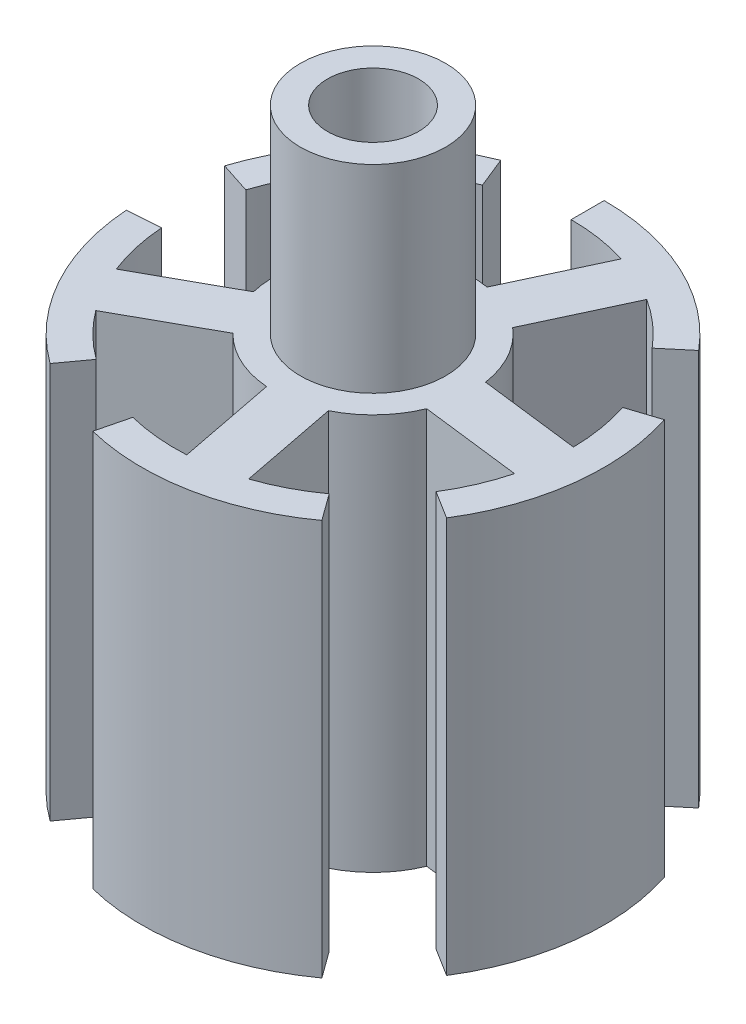
from build123d import *

# Parameters (mm, degrees)
BOSS_EXTRUDE2_DEPTH   = 30
BOSS_EXTRUDE2_2_DEPTH = 30
BOSS_EXTRUDE2_3_DEPTH = 30
BOSS_EXTRUDE2_4_DEPTH = 30
BOSS_EXTRUDE2_5_DEPTH = 30
BOSS_EXTRUDE3_DEPTH   = 30
SKETCH3_R             = 7.5
BOSS_EXTRUDE4_DEPTH   = 30
SKETCH5_R             = 5.5
BOSS_EXTRUDE5_DEPTH   = 15
SKETCH4_R             = 3.45
CUT_EXTRUDE1_DEPTH    = 52.35659646


with BuildPart() as part:
    # Sketch1 → Boss-Extrude2 (new body)
    with BuildSketch(Plane(origin=(0, 0, 0), x_dir=(1, 0, 0), z_dir=(0, 1, 0))):
        with BuildLine():
            Line((0, 17.5), (0, 15))
            ThreePointArc((0, 15), (6.339273926, 13.594616806), (11.490666647, 9.641814145))
            Line((11.490666647, 9.641814145), (13.405777755, 11.24878317))
            ThreePointArc((13.405777755, 11.24878317), (7.39581958, 15.860386273), (0, 17.5))
        make_face()
    extrude(amount=BOSS_EXTRUDE2_DEPTH)



with BuildPart() as body_2:
    # Sketch1 → Boss-Extrude2 2 (new body)
    with BuildSketch(Plane(origin=(0, 0, 0), x_dir=(1, 0, 0), z_dir=(0, 1, 0))):
        with BuildLine():
            Line((16.643489035, 5.407797402), (14.265847744, 4.635254916))
            ThreePointArc((14.265847744, 4.635254916), (14.888192275, -1.828040151), (12.720721442, -7.948788963))
            Line((12.720721442, -7.948788963), (14.840841683, -9.273587124))
            ThreePointArc((14.840841683, -9.273587124), (17.369557654, -2.13271351), (16.643489035, 5.407797402))
        make_face()
    extrude(amount=BOSS_EXTRUDE2_2_DEPTH)


with BuildPart() as body_3:
    # Sketch1 → Boss-Extrude2 3 (new body)
    with BuildSketch(Plane(origin=(0, 0, 0), x_dir=(1, 0, 0), z_dir=(0, 1, 0))):
        with BuildLine():
            Line((10.286241915, -14.157797402), (8.816778784, -12.135254916))
            ThreePointArc((8.816778784, -12.135254916), (2.862134931, -14.724407752), (-3.628828434, -14.554435894))
            Line((-3.628828434, -14.554435894), (-4.233633173, -16.98017521))
            ThreePointArc((-4.233633173, -16.98017521), (3.339157419, -17.17847571), (10.286241915, -14.157797402))
        make_face()
    extrude(amount=BOSS_EXTRUDE2_3_DEPTH)


with BuildPart() as body_4:
    # Sketch1 → Boss-Extrude2 4 (new body)
    with BuildSketch(Plane(origin=(0, 0, 0), x_dir=(1, 0, 0), z_dir=(0, 1, 0))):
        with BuildLine():
            Line((-10.286241915, -14.157797402), (-8.816778784, -12.135254916))
            ThreePointArc((-8.816778784, -12.135254916), (-13.119295607, -7.272144304), (-14.963460754, -1.046347106))
            Line((-14.963460754, -1.046347106), (-17.45737088, -1.220738291))
            ThreePointArc((-17.45737088, -1.220738291), (-15.305844875, -8.484168354), (-10.286241915, -14.157797402))
        make_face()
    extrude(amount=BOSS_EXTRUDE2_4_DEPTH)


with BuildPart() as body_5:
    # Sketch1 → Boss-Extrude2 5 (new body)
    with BuildSketch(Plane(origin=(0, 0, 0), x_dir=(1, 0, 0), z_dir=(0, 1, 0))):
        with BuildLine():
            Line((-16.643489035, 5.407797402), (-14.265847744, 4.635254916))
            ThreePointArc((-14.265847744, 4.635254916), (-10.970305524, 10.229975401), (-5.619098901, 13.907757819))
            Line((-5.619098901, 13.907757819), (-6.555615385, 16.225717455))
            ThreePointArc((-6.555615385, 16.225717455), (-12.798689778, 11.934971301), (-16.643489035, 5.407797402))
        make_face()
    extrude(amount=BOSS_EXTRUDE2_5_DEPTH)


with BuildPart() as part_1:
    add(part.part)

    add(body_2.part)  # Boss-Extrude3 merges body 2

    add(body_3.part)  # Boss-Extrude3 merges body 3

    add(body_4.part)  # Boss-Extrude3 merges body 4

    add(body_5.part)  # Boss-Extrude3 merges body 5
    # Sketch2 → Boss-Extrude3 (add)
    with BuildSketch(Plane(origin=(0, 0, 0), x_dir=(1, 0, 0), z_dir=(0, 1, 0))):
        Polygon((2.975983844, 1.649614781), (8.1518895, 12.749380282), (4.526658352, 14.439853329), (-0.649247305, 3.340087828), (-9.606308804, 11.692682804), (-12.334302244, 8.767267998), (-3.377240745, 0.414673022), (-14.088914848, -5.522904889), (-12.149676367, -9.021383718), (-1.438002264, -3.083805807), (0.898880564, -15.106025742), (4.825389298, -14.342789761), (2.48850647, -2.320569825), (14.644453588, -3.813132454), (15.131930961, 0.157052152), align=None)
        Polygon((-0.334260109, 0.311702594), (0.152686649, 0.084635592), (0.087207921, -0.448645859), align=None, mode=Mode.SUBTRACT)
    extrude(amount=BOSS_EXTRUDE3_DEPTH)

    # Sketch3 → Boss-Extrude4 (add)
    with BuildSketch(Plane(origin=(0, 0, 0), x_dir=(1, 0, 0), z_dir=(0, 1, 0))):
        Circle(SKETCH3_R)
    extrude(amount=BOSS_EXTRUDE4_DEPTH)

    # Sketch5 → Boss-Extrude5 (add)
    with BuildSketch(Plane(origin=(0, 30, 0), x_dir=(1, 0, 0), z_dir=(0, 1, 0))):
        Circle(SKETCH5_R)
    extrude(amount=BOSS_EXTRUDE5_DEPTH)

    # Sketch4 → Cut-Extrude1 (cut, through all)
    with BuildSketch(Plane(origin=(0, 0, 0), x_dir=(1, 0, 0), z_dir=(0, 1, 0))):
        Circle(SKETCH4_R)
    extrude(amount=CUT_EXTRUDE1_DEPTH, mode=Mode.SUBTRACT)


solid = part_1.part
